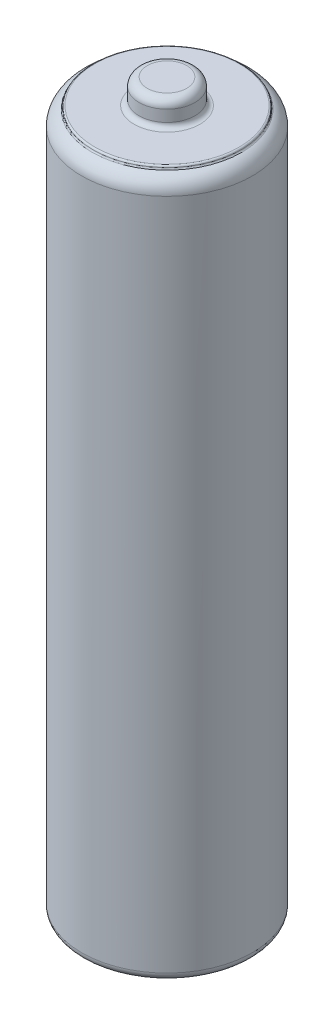
from build123d import *

# Parameters (mm, degrees)
SKETCH1_R           = 5.2
BOSS_EXTRUDE1_DEPTH = 42.4
SKETCH2_R           = 4.5
BOSS_EXTRUDE2_DEPTH = 0.3
BOSS_EXTRUDE3_START = 0.2
SKETCH3_R           = 4.5
BOSS_EXTRUDE3_DEPTH = 0.2
SKETCH4_R           = 1.7
BOSS_EXTRUDE4_DEPTH = 1.5
FILLET1_R           = 0.5
FILLET2_R           = 0.1
FILLET3_R           = 0.1
FILLET4_R           = 1
FILLET7_R           = 0.3
FILLET8_R           = 0.2
FILLET9_R           = 0.5


with BuildPart() as part:
    # Sketch1 → Boss-Extrude1 (new body)
    with BuildSketch(Plane(origin=(0, 0, 0), x_dir=(1, 0, 0), z_dir=(0, 1, 0))):
        with Locations(Location((0, 0, 0), (0, 0, 270))):
            Circle(SKETCH1_R)
    extrude(amount=BOSS_EXTRUDE1_DEPTH)

    # Sketch2 → Boss-Extrude2 (add)
    with BuildSketch(Plane.XZ):
        with Locations(Location((0, 0, 0), (0, 0, 90))):
            Circle(SKETCH2_R)
    extrude(amount=BOSS_EXTRUDE2_DEPTH)

    # Sketch3 → Boss-Extrude3 (add)
    with BuildSketch(Plane(origin=(0, 42.4, 0), x_dir=(1, 0, 0), z_dir=(0, 1, 0)).offset(BOSS_EXTRUDE3_START)):
        with Locations(Location((0, 0, 0), (0, 0, 270))):
            Circle(SKETCH3_R)
    extrude(amount=-BOSS_EXTRUDE3_DEPTH)

    # Sketch4 → Boss-Extrude4 (add)
    with BuildSketch(Plane(origin=(0, 42.6, 0), x_dir=(1, 0, 0), z_dir=(0, 1, 0))):
        with Locations(Location((0, 0, 0), (0, 0, 270))):
            Circle(SKETCH4_R)
    extrude(amount=BOSS_EXTRUDE4_DEPTH)

    # Fillet1
    fillet1_edges = [part.edges().sort_by_distance(p)[0] for p in [
        (0, 44.1, -1.7),
    ]]
    fillet(fillet1_edges, radius=FILLET1_R)

    # Fillet2
    fillet2_edges = [part.edges().sort_by_distance(p)[0] for p in [
        (0, 42.4, -4.5),
    ]]
    fillet(fillet2_edges, radius=FILLET2_R)

    # Fillet3
    fillet3_edges = [part.edges().sort_by_distance(p)[0] for p in [
        (0, 42.6, -4.5),
    ]]
    fillet(fillet3_edges, radius=FILLET3_R - 0.0001)  # a hair under: the kernel refuses the full size

    # Fillet4
    fillet4_edges = [part.edges().sort_by_distance(p)[0] for p in [
        (0, 42.4, -5.2),
    ]]
    fillet(fillet4_edges, radius=FILLET4_R)

    # Fillet7
    fillet7_edges = [part.edges().sort_by_distance(p)[0] for p in [
        (0, 42.6, -1.7),
    ]]
    fillet(fillet7_edges, radius=FILLET7_R)

    # Fillet8
    fillet8_edges = [part.edges().sort_by_distance(p)[0] for p in [
        (0, -0.3, -4.5),
    ]]
    fillet(fillet8_edges, radius=FILLET8_R)

    # Fillet9
    fillet9_edges = [part.edges().sort_by_distance(p)[0] for p in [
        (0, 0, -5.2),
    ]]
    fillet(fillet9_edges, radius=FILLET9_R)


solid = part.part
